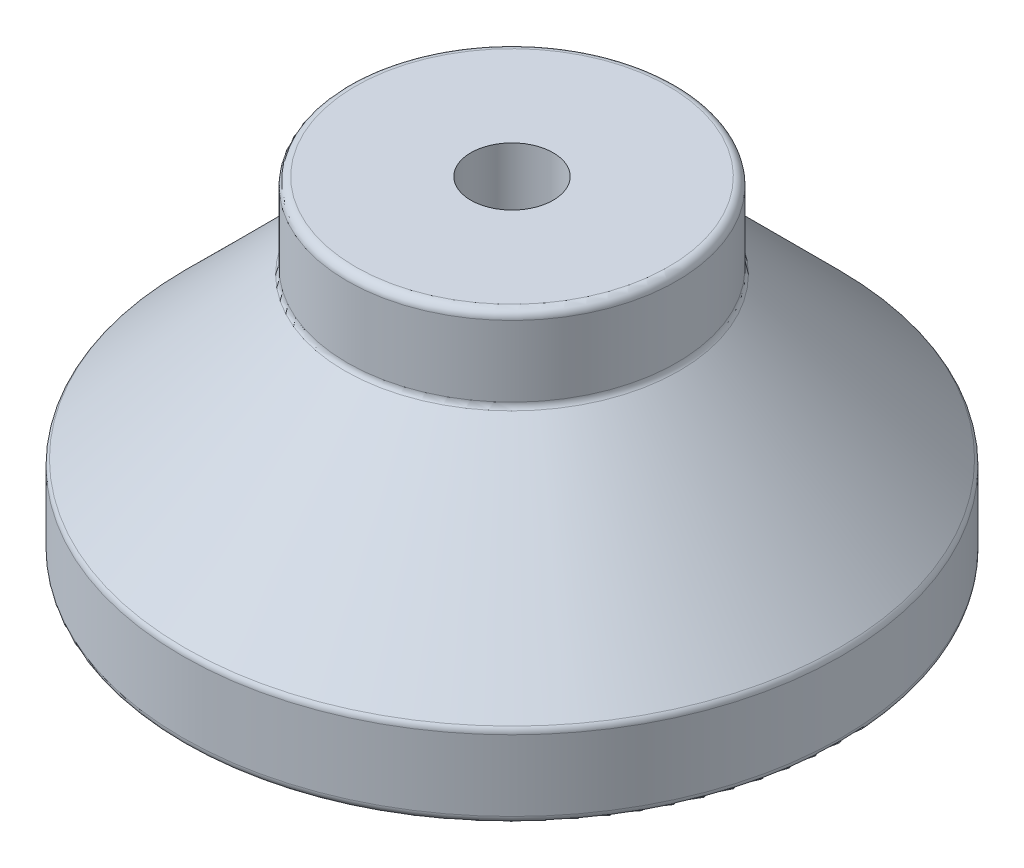
from build123d import *

# Parameters (mm, degrees)
SKETCH1_R           = 20
BOSS_EXTRUDE1_DEPTH = 20
CUT_EXTRUDE1_START  = -15
SKETCH2_R           = 20
SKETCH2_R_2         = 10
SKETCH2_R_3         = 2.5
CUT_EXTRUDE1_DEPTH  = 15
CHAMFER1_SIZE       = 10


with BuildPart() as part:
    # Sketch1 → Boss-Extrude1 (new body)
    with BuildSketch(Plane(origin=(0, 0, 0), x_dir=(1, 0, 0), z_dir=(0, 1, 0))):
        with Locations(Location((0, 0, 0), (0, 0, 270))):
            Circle(SKETCH1_R)
    extrude(amount=BOSS_EXTRUDE1_DEPTH)

    # Sketch2 → Cut-Extrude1 (cut)
    # profile 1 of 2: a face of its own
    with BuildSketch(Plane(origin=(0, 20, 0), x_dir=(1, 0, 0), z_dir=(0, 1, 0)).offset(CUT_EXTRUDE1_START)):
        with Locations(Location((0, 0, 0), (0, 0, 270))):
            Circle(SKETCH2_R)
        with Locations(Location((0, 0, 0), (0, 0, 270))):
            Circle(SKETCH2_R_2, mode=Mode.SUBTRACT)
    # profile 2 of 2: a face of its own
    with BuildSketch(Plane(origin=(0, 20, 0), x_dir=(1, 0, 0), z_dir=(0, 1, 0)).offset(CUT_EXTRUDE1_START)):
        with Locations(Location((0, 0, 0), (0, 0, 270))):
            Circle(SKETCH2_R_3)
    extrude(amount=CUT_EXTRUDE1_DEPTH, mode=Mode.SUBTRACT)

    # Chamfer1
    chamfer1_edges = [part.edges().sort_by_distance(p)[0] for p in [
        (0, 5, -10),
    ]]
    chamfer(chamfer1_edges, length=CHAMFER1_SIZE - 0.0001)  # a hair under: the kernel refuses the full size

    # Fillet2: read off the stored shape, not the designer's step
    # Fillet2 outline → Fillet2 (revolve, cut)
    with BuildSketch(Plane.XY):
        with BuildLine():
            Line((20, 5.146446609), (19.853553391, 5.146446609))
            ThreePointArc((19.853553391, 5.146446609), (19.961939766, 4.984234935), (20, 4.792893219))
            Line((20, 4.792893219), (20, 5.146446609))
        make_face()
        with BuildLine():
            Line((20, 0), (20, 0.5))
            ThreePointArc((20, 0.5), (19.853553391, 0.146446609), (19.5, 0))
            Line((19.5, 0), (20, 0))
        make_face()
        with BuildLine():
            ThreePointArc((9.5, 20), (9.853553391, 19.853553391), (10, 19.5))
            Line((10, 19.5), (10, 20))
            Line((10, 20), (9.5, 20))
        make_face()
    revolve(axis=Axis((0, 0, 0), (0, 1, 0)), mode=Mode.SUBTRACT)

    # Fillet2 2 outline → Fillet2 2 (revolve)
    with BuildSketch(Plane.XY):
        with BuildLine():
            Line((10, 14.853553391), (10.146446609, 14.853553391))
            ThreePointArc((10.146446609, 14.853553391), (10.038060234, 15.015765065), (10, 15.207106781))
            Line((10, 15.207106781), (10, 14.853553391))
        make_face()
    revolve(axis=Axis((0, 0, 0), (0, 1, 0)))


solid = part.part
